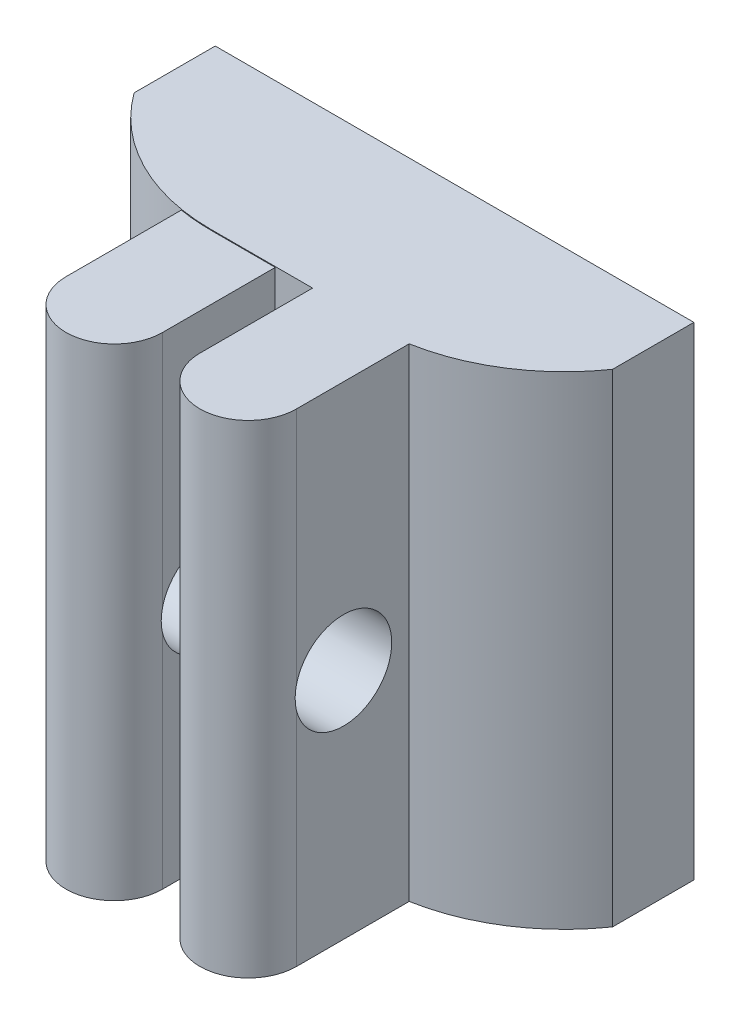
from build123d import *

# Parameters (mm, degrees)
SKETCH1_W               = 17
SKETCH1_H               = 15
BOSS_EXTRUDE1_DEPTH     = 5
SKETCH2_W               = 3
SKETCH2_H               = 15
SKETCH2_H_2             = 14.97636143
BOSS_EXTRUDE2_DEPTH     = 5
CUT_EXTRUDE2_DEPTH      = 21.185301583
CUT_EXTRUDE2_DEPTH_BACK = 21.185301583
SKETCH4_R               = 1.5
FILLET1_R               = 6
FILLET3_RADIUS          = 1.5
FILLET3_LENGTH          = 14.97636143
FILLET4_RADIUS          = 1.5
FILLET4_LENGTH          = 15
SKETCH5_W               = 1.007967197
SKETCH5_H               = 15
SKETCH5_W_2             = 1.056413299
CUT_EXTRUDE4_DEPTH      = 10


with BuildPart() as part:
    # Sketch1 → Boss-Extrude1 (new body)
    with BuildSketch(Plane.XY):
        with Locations((-8.5, -7.5)):
            Rectangle(SKETCH1_W, SKETCH1_H)
    extrude(amount=BOSS_EXTRUDE1_DEPTH)

    # Sketch2 → Boss-Extrude2 (add)
    with BuildSketch(Plane.XY.offset(5)):
        with Locations((-6.42, -7.5)):
            Rectangle(SKETCH2_W, SKETCH2_H)
        with Locations((-10.58, -7.511819285)):
            Rectangle(SKETCH2_W, SKETCH2_H_2)
    extrude(amount=BOSS_EXTRUDE2_DEPTH)

    # Sketch4 → Cut-Extrude2 (cut, two sides: drawn at the far end of the back side and taken through both)
    with BuildSketch(Plane(origin=(-9.08, 0, 0), x_dir=(0, 0, -1), z_dir=(1, 0, 0)).offset(-CUT_EXTRUDE2_DEPTH_BACK)):
        with Locations(Location((-7.041389116, -7.762480296, 0), (0, 0, 270))):
            Circle(SKETCH4_R)
    extrude(amount=CUT_EXTRUDE2_DEPTH + CUT_EXTRUDE2_DEPTH_BACK, mode=Mode.SUBTRACT)

    # Fillet1
    # the kernel refuses this fillet: 6 mm, written as the material it takes off along each edge
    with BuildSketch(Plane(origin=(0, -29.754999153, 5), x_dir=(0, 0, -1), z_dir=(0, 1, 0))) as fillet1_piece_1:
        with BuildLine():
            CenterArc((5.901999661, 6), FILLET1_R, 190.369759805, 79.630240195)
            Line((0, 4.92), (0, 0))
            Line((0, 0), (5.901999661, 0))
        make_face()
    extrude(amount=44.509998306, mode=Mode.SUBTRACT)
    # the kernel refuses this fillet: 6 mm, written as the material it takes off along each edge
    with BuildSketch(Plane(origin=(-17, 14.790199458, 5), x_dir=(0, 0, -1), z_dir=(0, -1, 0))) as fillet1_2_piece_1_section:
        with BuildLine():
            CenterArc((6, 5.916079783), FILLET1_R, 180, 80.405931773)
            Line((0, 5.916079783), (0, 0))
            Line((0, 0), (5, 0))
        make_face()
    fillet1_2_piece_1 = extrude(amount=44.580398916, mode=Mode.PRIVATE)
    fillet1_2_piece_1 = split(fillet1_2_piece_1, bisect_by=Plane(origin=(-17, -0.02363857, 5), z_dir=(0, 1, 0)), keep=Keep.TOP, mode=Mode.PRIVATE)
    fillet1_2_piece_1 = split(fillet1_2_piece_1, bisect_by=Plane(origin=(-12.08, 14.790199458, 5), z_dir=(-1, 0, 0)), keep=Keep.TOP, mode=Mode.PRIVATE)
    add(fillet1_2_piece_1, mode=Mode.SUBTRACT)
    with BuildSketch(Plane(origin=(-17, 14.790199458, 5), x_dir=(0, 0, -1), z_dir=(0, -1, 0))) as fillet1_2_piece_2_section:
        with BuildLine():
            CenterArc((6, 5.916079783), FILLET1_R, 180, 80.405931773)
            Line((0, 5.916079783), (0, 0))
            Line((0, 0), (5, 0))
        make_face()
    fillet1_2_piece_2 = extrude(amount=44.580398916, mode=Mode.PRIVATE)
    fillet1_2_piece_2 = split(fillet1_2_piece_2, bisect_by=Plane(origin=(-17, -0.02363857, 5), z_dir=(0, 1, 0)), keep=Keep.TOP, mode=Mode.PRIVATE)
    fillet1_2_piece_2 = split(fillet1_2_piece_2, bisect_by=Plane(origin=(-12.08, 14.790199458, 5), z_dir=(1, 0, 0)), keep=Keep.TOP, mode=Mode.PRIVATE)
    add(fillet1_2_piece_2, mode=Mode.SUBTRACT)
    with BuildSketch(Plane(origin=(-17, 14.790199458, 5), x_dir=(0, 0, -1), z_dir=(0, -1, 0))) as fillet1_2_piece_3_section:
        with BuildLine():
            CenterArc((6, 5.916079783), FILLET1_R, 180, 80.405931773)
            Line((0, 5.916079783), (0, 0))
            Line((0, 0), (5, 0))
        make_face()
    fillet1_2_piece_3 = extrude(amount=44.580398916, mode=Mode.PRIVATE)
    fillet1_2_piece_3 = split(fillet1_2_piece_3, bisect_by=Plane(origin=(-17, -0.02363857, 5), z_dir=(0, -1, 0)), keep=Keep.TOP, mode=Mode.PRIVATE)
    fillet1_2_piece_3 = split(fillet1_2_piece_3, bisect_by=Plane(origin=(-12.08, 14.790199458, 5), z_dir=(-1, 0, 0)), keep=Keep.TOP, mode=Mode.PRIVATE)
    add(fillet1_2_piece_3, mode=Mode.SUBTRACT)

    # Fillet3: full round fillet: the end face becomes a half cylinder, R = half its width
    fillet3_face = Plane((-10.58, -7.511819285, 10), x_dir=(0, -1, 0), z_dir=(0, 0, 1))  # on the end face: x along it, z out of the body
    fillet3_slab = fillet3_face.offset(-FILLET3_RADIUS / 2) * Box(FILLET3_LENGTH, 2 * FILLET3_RADIUS, FILLET3_RADIUS, mode=Mode.PRIVATE)  # the body's end, R deep
    fillet3_round = Plane((-10.58, -7.511819285, 8.5), x_dir=(0, 0, 1), z_dir=(0, -1, 0)) * Cylinder(FILLET3_RADIUS, FILLET3_LENGTH, mode=Mode.PRIVATE)  # its axis R under the face
    add(fillet3_slab - fillet3_round, mode=Mode.SUBTRACT)

    # Fillet4: full round fillet: the end face becomes a half cylinder, R = half its width
    fillet4_face = Plane((-6.42, -7.5, 10), x_dir=(0, -1, 0), z_dir=(0, 0, 1))  # on the end face: x along it, z out of the body
    fillet4_slab = fillet4_face.offset(-FILLET4_RADIUS / 2) * Box(FILLET4_LENGTH, 2 * FILLET4_RADIUS, FILLET4_RADIUS, mode=Mode.PRIVATE)  # the body's end, R deep
    fillet4_round = Plane((-6.42, -7.5, 8.5), x_dir=(0, 0, 1), z_dir=(0, -1, 0)) * Cylinder(FILLET4_RADIUS, FILLET4_LENGTH, mode=Mode.PRIVATE)  # its axis R under the face
    add(fillet4_slab - fillet4_round, mode=Mode.SUBTRACT)

    # Sketch5 → Cut-Extrude4 (cut)
    with BuildSketch(Plane.XY):
        with Locations((-0.572171345, -7.5)):
            Rectangle(SKETCH5_W, SKETCH5_H)
        with Locations((-16.471793351, -7.5)):
            Rectangle(SKETCH5_W_2, SKETCH5_H)
    extrude(amount=CUT_EXTRUDE4_DEPTH, mode=Mode.SUBTRACT)


solid = part.part
